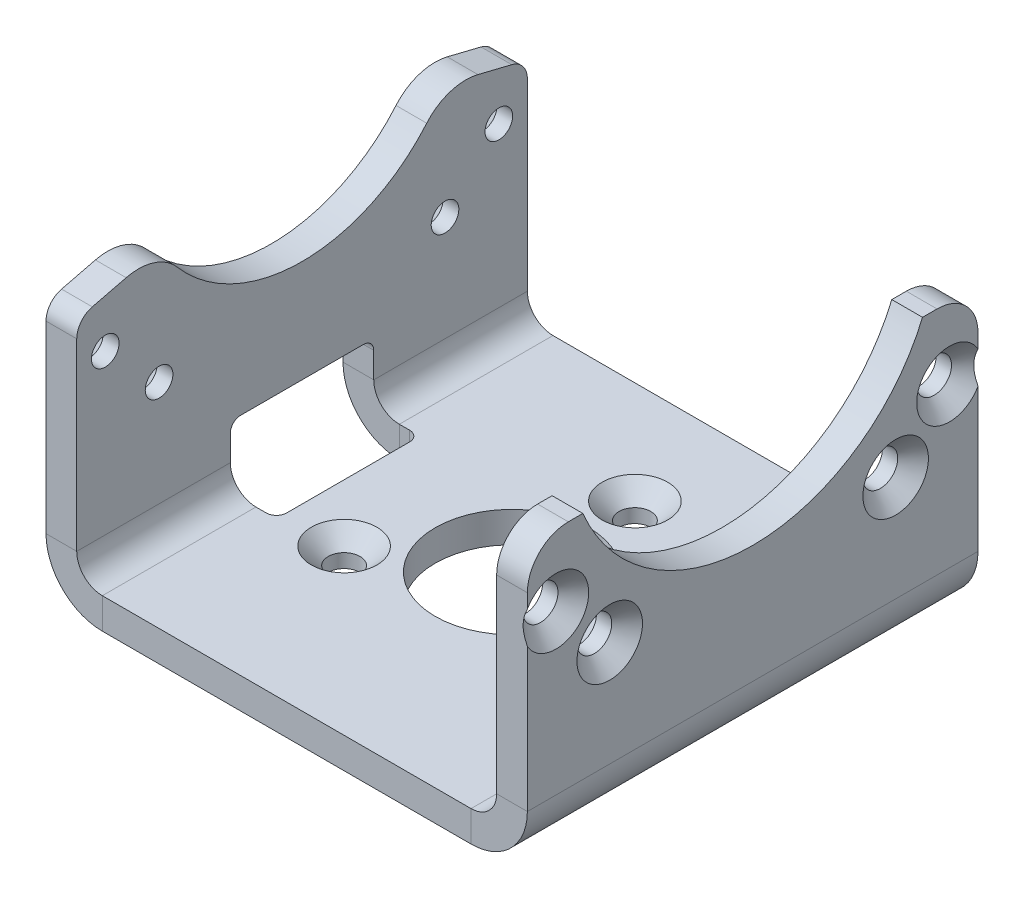
from build123d import *

# Parameters (mm, degrees)
SKETCH_1_W                       = 41
SKETCH_1_H                       = 44
SM_BASE_FLANGE_1_DEPTH           = 3
SM_EDGE_FLANGE_1_STRIP_W         = 17
SM_EDGE_FLANGE_1_STRIP_H         = 3
SM_EDGE_FLANGE_1_STRIP_CUT_DEPTH = 44
SM_EDGE_FLANGE_1_DEPTH           = 44
SKETCH_11_R                      = 16
CUT_EXTRUDE_1_DEPTH              = 10
HOLE_WIZARD_M3_1_D               = 3.1
HOLE_WIZARD_M3_1_DEPTH           = 5.2
HOLE_WIZARD_M3_1_CSINK_D         = 6.4
HOLE_WIZARD_M3_1_CSINK_ANGLE     = 90
HOLE_WIZARD_M3_1_TIP             = 0.931333959
CUT_EXTRUDE_START                = -10
CUT_EXTRUDE_2_DEPTH              = 10
HOLE_WIZARD_M2_5_1_D             = 2.7
HOLE_WIZARD_M2_5_1_DEPTH         = 5.2
HOLE_WIZARD_M2_5_1_CSINK_D       = 5.6
HOLE_WIZARD_M2_5_1_CSINK_ANGLE   = 90
HOLE_WIZARD_M2_5_1_TIP           = 0.811161836
SM_EDGE_FLANGE_2_STRIP_W         = 17
SM_EDGE_FLANGE_2_STRIP_H         = 3
SM_EDGE_FLANGE_2_STRIP_CUT_DEPTH = 44
SM_EDGE_FLANGE_2_DEPTH           = 44
FILLET_1_R                       = 4
FILLET_2_R                       = 1
HOLE_WIZARD_M3_2_AT_2_COUNT      = 2
HOLE_WIZARD_M3_2_AT_2_PITCH      = 7.430637089
HOLE_WIZARD_M3_2_AT_3_COUNT      = 2
HOLE_WIZARD_M3_2_AT_3_PITCH      = 27.919799484
HOLE_WIZARD_M3_2_AT_4_COUNT      = 2
HOLE_WIZARD_M3_2_AT_4_PITCH      = 33.587572106
SKETCH_28_R                      = 18
CUT_EXTRUDE_3_DEPTH              = 10
SKETCH_29_R                      = 7.5
CUT_EXTRUDE_4_DEPTH              = 10
SKETCH_30_W                      = 10
SKETCH_30_H                      = 14
CUT_EXTRUDE_5_DEPTH              = 9
CUT_EXTRUDE_6_DEPTH              = 10
FILLET_3_R                       = 2
FILLET_4_R                       = 5
FILLET_5_R                       = 1


# Sheet-metal steps are written as plain solids
with BuildPart() as part:
    # Sketch 1 → 基体-法兰1 (new body)
    with BuildSketch(Plane(origin=(0, 0, 0), x_dir=(1, 0, 0), z_dir=(0, 1, 0))):
        Rectangle(SKETCH_1_W, SKETCH_1_H)
    extrude(amount=-SM_BASE_FLANGE_1_DEPTH)

    # 边线-法兰1 strip (across the edge) → 边线-法兰1 strip cut (cut)
    with BuildSketch(Plane(origin=(-20.5, 0, -22), x_dir=(1, 0, 0), z_dir=(0, 0, 1))):
        with Locations((-6, -1.5)):
            Rectangle(SM_EDGE_FLANGE_1_STRIP_W, SM_EDGE_FLANGE_1_STRIP_H)
    extrude(amount=SM_EDGE_FLANGE_1_STRIP_CUT_DEPTH, mode=Mode.SUBTRACT)

    # 边线-法兰1 section (across the edge) → 边线-法兰1 (add)
    with BuildSketch(Plane(origin=(-20.5, 0, -22), x_dir=(1, 0, 0), z_dir=(0, 0, 1))):
        with BuildLine():
            Line((-3, 2.5), (-3, 55))
            Line((-3, 55), (0, 55))
            Line((0, 55), (0, 2.5))
            ThreePointArc((0, 2.5), (0.732233047, 0.732233047), (2.5, 0))
            Line((2.5, 0), (2.5, -3))
            ThreePointArc((2.5, -3), (-1.389087297, -1.389087297), (-3, 2.5))
        make_face()
    extrude(amount=SM_EDGE_FLANGE_1_DEPTH)

    # 草图11 → 切除-拉伸1 (cut)
    with BuildSketch(Plane(origin=(-20.5, 0, 0), x_dir=(0, 0, -1), z_dir=(1, 0, 0))):
        with Locations(Location((0, 32, 0), (0, 0, 90))):
            Circle(SKETCH_11_R)
    extrude(amount=-CUT_EXTRUDE_1_DEPTH, mode=Mode.SUBTRACT)

    # M3 开槽半沉头螺钉的锥形沉头孔1
    with Locations(Plane(origin=(0, 0, 0), x_dir=(1, 0, 0), z_dir=(0, 1, 0))):
        with Locations((0, 12), (10.392304845, -6), (-10.392304845, -6)):
            CounterSinkHole(HOLE_WIZARD_M3_1_D / 2, HOLE_WIZARD_M3_1_CSINK_D / 2, depth=HOLE_WIZARD_M3_1_DEPTH, counter_sink_angle=HOLE_WIZARD_M3_1_CSINK_ANGLE)
            with Locations((0, 0, -(HOLE_WIZARD_M3_1_DEPTH + HOLE_WIZARD_M3_1_TIP / 2))):  # 118° drill point
                Cone(0, HOLE_WIZARD_M3_1_D / 2, HOLE_WIZARD_M3_1_TIP, mode=Mode.SUBTRACT)

    # 草图17 → 切除-拉伸2 (cut)
    with BuildSketch(Plane.ZY.offset(23.5).offset(CUT_EXTRUDE_START)):
        with BuildLine():
            Line((-16, 32), (-16, 55))
            ThreePointArc((-16, 55), (0, 71), (16, 55))
            Line((16, 55), (16, 32))
            ThreePointArc((16, 32), (0, 16), (-16, 32))
        make_face()
    extrude(amount=CUT_EXTRUDE_2_DEPTH, mode=Mode.SUBTRACT)

    # M2.5 开槽半沉头螺钉的锥形沉头孔1
    with Locations(Plane.ZY.offset(23.5)):
        with Locations((19.214153616, 18.040100258), (19.214153616, 45.959899742), (-19.214153616, 45.959899742), (-19.214153616, 18.040100258), (-13.959899742, 12.785846384), (13.959899742, 12.785846384)):
            CounterSinkHole(HOLE_WIZARD_M2_5_1_D / 2, HOLE_WIZARD_M2_5_1_CSINK_D / 2, depth=HOLE_WIZARD_M2_5_1_DEPTH, counter_sink_angle=HOLE_WIZARD_M2_5_1_CSINK_ANGLE)
            with Locations((0, 0, -(HOLE_WIZARD_M2_5_1_DEPTH + HOLE_WIZARD_M2_5_1_TIP / 2))):  # 118° drill point
                Cone(0, HOLE_WIZARD_M2_5_1_D / 2, HOLE_WIZARD_M2_5_1_TIP, mode=Mode.SUBTRACT)

    # 边线-法兰2 strip (across the edge) → 边线-法兰2 strip cut (cut)
    with BuildSketch(Plane(origin=(20.5, 0, 22), x_dir=(-1, 0, 0), z_dir=(0, 0, -1))):
        with Locations((-6, -1.5)):
            Rectangle(SM_EDGE_FLANGE_2_STRIP_W, SM_EDGE_FLANGE_2_STRIP_H)
    extrude(amount=SM_EDGE_FLANGE_2_STRIP_CUT_DEPTH, mode=Mode.SUBTRACT)

    # 边线-法兰2 section (across the edge) → 边线-法兰2 (add)
    with BuildSketch(Plane(origin=(20.5, 0, 22), x_dir=(-1, 0, 0), z_dir=(0, 0, -1))):
        with BuildLine():
            Line((-3, 2.5), (-3, 25))
            Line((-3, 25), (0, 25))
            Line((0, 25), (0, 2.5))
            ThreePointArc((0, 2.5), (0.732233047, 0.732233047), (2.5, 0))
            Line((2.5, 0), (2.5, -3))
            ThreePointArc((2.5, -3), (-1.389087297, -1.389087297), (-3, 2.5))
        make_face()
    extrude(amount=SM_EDGE_FLANGE_2_DEPTH)

    # 圆角1
    fillet_1_edges = [part.edges().sort_by_distance(p)[0] for p in [
        (22, 25, 22),
        (22, 25, -22),
        (-22, 55, -22),
        (-22, 55, 22),
    ]]
    fillet(fillet_1_edges, radius=FILLET_1_R)

    # 圆角2
    fillet_2_edges = [part.edges().sort_by_distance(p)[0] for p in [
        (-22, 55, -16),
        (-22, 55, 16),
    ]]
    fillet(fillet_2_edges, radius=FILLET_2_R)

    # 草图27 → M3 开槽半沉头螺钉的锥形沉头孔2 (revolve, cut)
    with BuildSketch(Plane(origin=(23.5, 12.785846384, 13.959899742), x_dir=(0, 0, -1), z_dir=(0, 1, 0))):
        Polygon((0, 0), (0, 3), (1.7, 3), (1.7, 1.5), (3.2, 0), align=None)
    hole_wizard_m3_2 = revolve(axis=Axis((29.85, 12.785846384, 13.959899742), (-1, 0, 0)), mode=Mode.SUBTRACT)

    # M3 开槽半沉头螺钉的锥形沉头孔2 at 2: M3 开槽半沉头螺钉的锥形沉头孔2 ×2
    with Locations(*[Vector(2.6296433264448836e-15, 0.7071067811865475, 0.7071067811865477) * (i * HOLE_WIZARD_M3_2_AT_2_PITCH) for i in range(1, HOLE_WIZARD_M3_2_AT_2_COUNT)]):
        add(hole_wizard_m3_2, mode=Mode.SUBTRACT)

    # M3 开槽半沉头螺钉的锥形沉头孔2 at 3: M3 开槽半沉头螺钉的锥形沉头孔2 ×2
    with Locations(*[(0, 0, -i * HOLE_WIZARD_M3_2_AT_3_PITCH) for i in range(1, HOLE_WIZARD_M3_2_AT_3_COUNT)]):
        add(hole_wizard_m3_2, mode=Mode.SUBTRACT)

    # M3 开槽半沉头螺钉的锥形沉头孔2 at 4: M3 开槽半沉头螺钉的锥形沉头孔2 ×2
    with Locations(*[Vector(0, 0.15643446504022762, -0.9876883405951383) * (i * HOLE_WIZARD_M3_2_AT_4_PITCH) for i in range(1, HOLE_WIZARD_M3_2_AT_4_COUNT)]):
        add(hole_wizard_m3_2, mode=Mode.SUBTRACT)

    # 草图28 → 切除-拉伸3 (cut)
    with BuildSketch(Plane(origin=(23.5, 0, 0), x_dir=(0, 0, -1), z_dir=(1, 0, 0))):
        with Locations((0, 32)):
            Circle(SKETCH_28_R)
    extrude(amount=-CUT_EXTRUDE_3_DEPTH, mode=Mode.SUBTRACT)

    # 草图29 → 切除-拉伸4 (cut)
    with BuildSketch(Plane.XZ.offset(3)):
        with Locations(Location((0, 0, 0), (0, 0, 270))):
            Circle(SKETCH_29_R)
    extrude(amount=-CUT_EXTRUDE_4_DEPTH, mode=Mode.SUBTRACT)

    # 草图30 → 切除-拉伸5 (cut)
    with BuildSketch(Plane.XZ.offset(3)):
        with Locations((-21, 0)):
            Rectangle(SKETCH_30_W, SKETCH_30_H)
    extrude(amount=-CUT_EXTRUDE_5_DEPTH, mode=Mode.SUBTRACT)

    # 草图32 → 切除-拉伸6 (cut)
    with BuildSketch(Plane.ZY.offset(23.5)):
        Polygon((-22, 22.040100258), (-13.879481118, 24.040100258), (-13.879481118, 65.768696361), (-22, 65.768696361), align=None)
        Polygon((13.879481118, 65.768696361), (13.879481118, 24.040100258), (22, 22.040100258), (22, 65.768696361), align=None)
    extrude(amount=-CUT_EXTRUDE_6_DEPTH, mode=Mode.SUBTRACT)

    # 圆角3
    fillet_3_edges = [part.edges().sort_by_distance(p)[0] for p in [
        (-22, 22.040100258, -22),
        (-22, 22.040100258, 22),
    ]]
    fillet(fillet_3_edges, radius=FILLET_3_R)

    # 圆角4
    fillet_4_edges = [part.edges().sort_by_distance(p)[0] for p in [
        (-22, 24.040100258, 13.879481118),
        (-22, 24.040100258, -13.879481118),
    ]]
    fillet(fillet_4_edges, radius=FILLET_4_R)

    # 圆角5
    fillet_5_edges = [part.edges().sort_by_distance(p)[0] for p in [
        (-22, 6, -7),
        (-16, -1.5, -7),
        (-22, 6, 7),
        (-16, -1.5, 7),
    ]]
    fillet(fillet_5_edges, radius=FILLET_5_R)


solid = part.part
